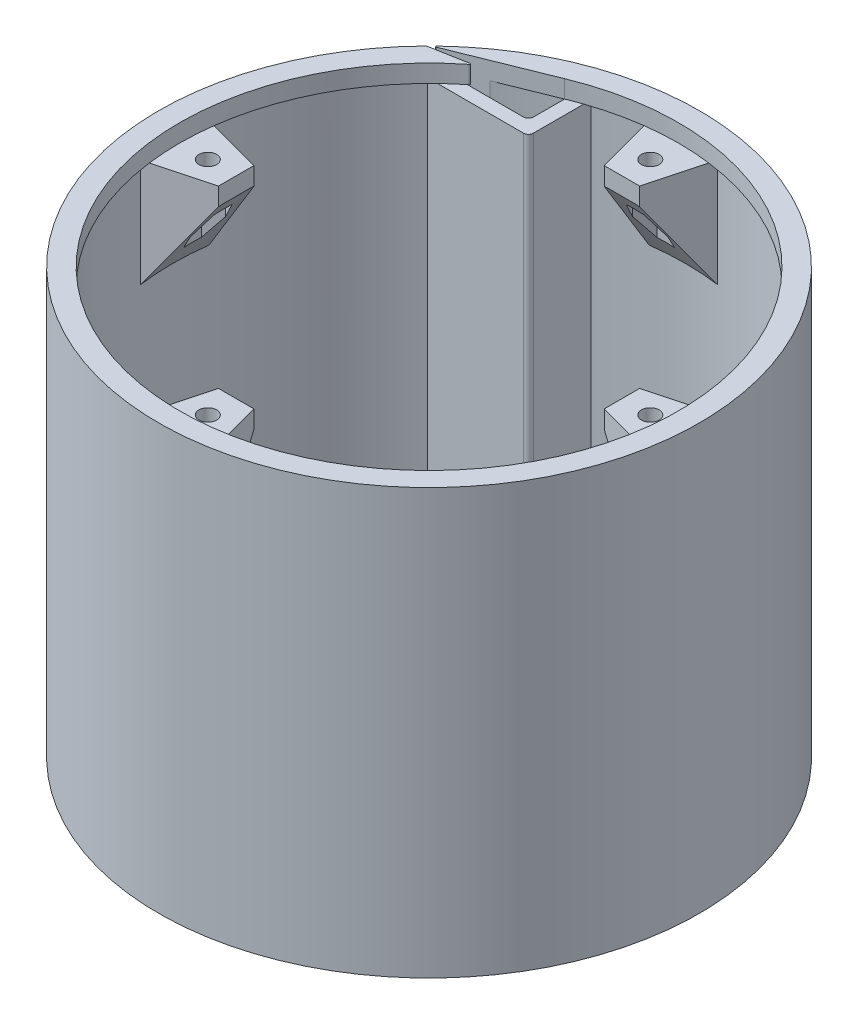
from build123d import *

# Parameters (mm, degrees)
SKETCH1_R           = 97.020853296
SKETCH1_R_2         = 92.020853296
BOSS_EXTRUDE1_DEPTH = 152.4
BOSS_EXTRUDE2_START = -6.35
SKETCH2_R           = 92.020853296
SKETCH2_R_2         = 89.535
BOSS_EXTRUDE2_DEPTH = 6.35
BOSS_EXTRUDE3_START = 6.35
SKETCH3_R           = 3.175
BOSS_EXTRUDE3_DEPTH = 6.35
CIRPATTERN1_COUNT   = 4
SKETCH4_R           = 3.175
BOSS_EXTRUDE4_DEPTH = 6.35
CHAMFER1_SIZE       = 32.28471384
CHAMFER1_SIZE_2     = 22.606
CUT_EXTRUDE1_DEPTH  = 25.4
CIRPATTERN2_COUNT   = 4
CUT_EXTRUDE6_START  = -152.4
CUT_EXTRUDE6_DEPTH  = 152.4
FILLET2_R           = 0.254
BOSS_EXTRUDE5_START = -152.4
BOSS_EXTRUDE5_DEPTH = 152.4
CUT_EXTRUDE8_START  = -6.35
CUT_EXTRUDE8_DEPTH  = 6.35
FILLET3_R           = 1.778


with BuildPart() as part:
    # Sketch1 → Boss-Extrude1 (new body)
    with BuildSketch(Plane(origin=(0, 0, 0), x_dir=(1, 0, 0), z_dir=(0, 1, 0))):
        with Locations(Location((0, 0, 0), (0, 0, 90))):
            Circle(SKETCH1_R)
        with Locations(Location((0, 0, 0), (0, 0, 90))):
            Circle(SKETCH1_R_2, mode=Mode.SUBTRACT)
    extrude(amount=BOSS_EXTRUDE1_DEPTH)

    # Sketch2 → Boss-Extrude2 (add)
    with BuildSketch(Plane(origin=(0, 152.4, 0), x_dir=(1, 0, 0), z_dir=(0, 1, 0)).offset(BOSS_EXTRUDE2_START)):
        with Locations(Location((0, 0, 0), (0, 0, 90))):
            Circle(SKETCH2_R)
        with Locations(Location((0, 0, 0), (0, 0, 270))):
            Circle(SKETCH2_R_2, mode=Mode.SUBTRACT)
    extrude(amount=BOSS_EXTRUDE2_DEPTH)

    # Sketch3 → Boss-Extrude3 (add)
    with BuildSketch(Plane.XZ.offset(-146.05).offset(BOSS_EXTRUDE3_START)):
        with BuildLine():
            Line((6.35, 69.215), (12.241655252, 91.20295674))
            ThreePointArc((12.241655252, 91.20295674), (0, 92.020853296), (-12.241655252, 91.20295674))
            Line((-12.241655252, 91.20295674), (-6.35, 69.215))
            Line((-6.35, 69.215), (6.35, 69.215))
        make_face()
        with Locations(Location((0, 79.375, 0), (0, 0, 270))):
            Circle(SKETCH3_R, mode=Mode.SUBTRACT)
    boss_extrude3 = extrude(amount=-BOSS_EXTRUDE3_DEPTH)

    # CirPattern1: Boss-Extrude3 ×4 about axis
    cirpattern1_axis = Axis((0, 0, 0), (0, 1, 0))
    for i in range(1, CIRPATTERN1_COUNT):
        add(boss_extrude3.rotate(cirpattern1_axis, i * 360 / CIRPATTERN1_COUNT))

    # Sketch4 → Boss-Extrude4 (add)
    # profile 1 of 9: a face of its own
    with BuildSketch(Plane.XZ):
        with BuildLine():
            Line((0, 34.925), (0, 7.62))
            Line((0, 7.62), (7.62, 7.62))
            Line((7.62, 7.62), (7.62, 91.704814712))
            ThreePointArc((7.62, 91.704814712), (3.813275508, 91.941809702), (0, 92.020853296))
            Line((0, 92.020853296), (0, 79.375))
            ThreePointArc((0, 79.375), (2.24506403, 78.44506403), (3.175, 76.2))
            ThreePointArc((3.175, 76.2), (2.24506403, 73.95493597), (0, 73.025))
            Line((0, 73.025), (0, 41.275))
            ThreePointArc((0, 41.275), (2.24506403, 40.34506403), (3.175, 38.1))
            ThreePointArc((3.175, 38.1), (2.24506403, 35.85493597), (0, 34.925))
        make_face()
    # profile 2 of 9: a face of its own
    with BuildSketch(Plane.XZ):
        with BuildLine():
            Line((-7.62, 7.62), (0, 7.62))
            Line((0, 7.62), (0, 34.925))
            ThreePointArc((0, 34.925), (-3.175, 38.1), (0, 41.275))
            Line((0, 41.275), (0, 73.025))
            ThreePointArc((0, 73.025), (-3.175, 76.2), (0, 79.375))
            Line((0, 79.375), (0, 92.020853296))
            ThreePointArc((0, 92.020853296), (-3.813275508, 91.941809702), (-7.62, 91.704814712))
            Line((-7.62, 91.704814712), (-7.62, 7.62))
        make_face()
    # profile 3 of 9: a face of its own
    with BuildSketch(Plane.XZ):
        with BuildLine():
            Line((7.62, 7.62), (7.62, 0))
            Line((7.62, 0), (7.62, -7.62))
            Line((7.62, -7.62), (91.704814712, -7.62))
            ThreePointArc((91.704814712, -7.62), (91.941809702, -3.813275508), (92.020853296, 0))
            ThreePointArc((92.020853296, 0), (91.941809702, 3.813275508), (91.704814712, 7.62))
            Line((91.704814712, 7.62), (7.62, 7.62))
        make_face()
        with Locations(Location((38.1, 0, 0), (0, 0, 270))):
            Circle(SKETCH4_R, mode=Mode.SUBTRACT)
        with Locations(Location((76.2, 0, 0), (0, 0, 270))):
            Circle(SKETCH4_R, mode=Mode.SUBTRACT)
    # profile 4 of 9: a face of its own
    with BuildSketch(Plane.XZ):
        with BuildLine():
            Line((7.62, -7.62), (0, -7.62))
            Line((0, -7.62), (-7.62, -7.62))
            Line((-7.62, -7.62), (-7.62, -91.704814712))
            ThreePointArc((-7.62, -91.704814712), (0, -92.020853296), (7.62, -91.704814712))
            Line((7.62, -91.704814712), (7.62, -7.62))
        make_face()
        with Locations(Location((0, -76.2, 0), (0, 0, 270))):
            Circle(SKETCH4_R, mode=Mode.SUBTRACT)
        with Locations(Location((0, -38.1, 0), (0, 0, 270))):
            Circle(SKETCH4_R, mode=Mode.SUBTRACT)
    # profile 5 of 9: a face of its own
    with BuildSketch(Plane.XZ):
        with BuildLine():
            Line((-7.62, -7.62), (-7.62, 0))
            Line((-7.62, 0), (-7.62, 7.62))
            Line((-7.62, 7.62), (-91.704814712, 7.62))
            ThreePointArc((-91.704814712, 7.62), (-92.020853296, 0), (-91.704814712, -7.62))
            Line((-91.704814712, -7.62), (-7.62, -7.62))
        make_face()
        with Locations(Location((-76.2, 0, 0), (0, 0, 270))):
            Circle(SKETCH4_R, mode=Mode.SUBTRACT)
        with Locations(Location((-38.1, 0, 0), (0, 0, 270))):
            Circle(SKETCH4_R, mode=Mode.SUBTRACT)
    # profile 6 of 9: a face of its own
    with BuildSketch(Plane.XZ):
        with BuildLine():
            ThreePointArc((-3.175, 0), (-2.24506403, 2.24506403), (0, 3.175))
            Line((0, 3.175), (0, 7.62))
            Line((0, 7.62), (-7.62, 7.62))
            Line((-7.62, 7.62), (-7.62, 0))
            Line((-7.62, 0), (-3.175, 0))
        make_face()
    # profile 7 of 9: a face of its own
    with BuildSketch(Plane.XZ):
        with BuildLine():
            Line((0, 7.62), (0, 3.175))
            ThreePointArc((0, 3.175), (2.24506403, 2.24506403), (3.175, 0))
            Line((3.175, 0), (7.62, 0))
            Line((7.62, 0), (7.62, 7.62))
            Line((7.62, 7.62), (0, 7.62))
        make_face()
    # profile 8 of 9: a face of its own
    with BuildSketch(Plane.XZ):
        with BuildLine():
            Line((7.62, 0), (3.175, 0))
            ThreePointArc((3.175, 0), (2.24506403, -2.24506403), (0, -3.175))
            Line((0, -3.175), (0, -7.62))
            Line((0, -7.62), (7.62, -7.62))
            Line((7.62, -7.62), (7.62, 0))
        make_face()
    # profile 9 of 9: a face of its own
    with BuildSketch(Plane.XZ):
        with BuildLine():
            ThreePointArc((0, -3.175), (-2.24506403, -2.24506403), (-3.175, 0))
            Line((-3.175, 0), (-7.62, 0))
            Line((-7.62, 0), (-7.62, -7.62))
            Line((-7.62, -7.62), (0, -7.62))
            Line((0, -7.62), (0, -3.175))
        make_face()
    extrude(amount=-BOSS_EXTRUDE4_DEPTH)

    # Chamfer1
    # the kernel refuses this chamfer: 32.28471384, 22.606 mm, written as the material it adds along each edge
    with BuildSketch(Plane(origin=(0, 139.7, 0), x_dir=(0.862152674351757, 0, 0.5066485627218467), z_dir=(0.5066485627218467, 0, -0.862152674351757))) as chamfer1_piece_1_section:
        Polygon((92.020853296, CHAMFER1_SIZE), (92.020853296 - CHAMFER1_SIZE_2, 0), (92.020853296, 0), align=None)
    chamfer1_piece_1 = revolve(axis=Axis((0, 139.7, 0), (0, -1, 0)), revolution_arc=119.118302195, mode=Mode.PRIVATE)
    chamfer1_piece_1 = split(chamfer1_piece_1, bisect_by=Plane(origin=(-11.379119343, 139.7, 3.049025839), z_dir=(-0.9659258262890701, 0, 0.2588190451025144)), keep=Keep.TOP, mode=Mode.PRIVATE)
    chamfer1_piece_1 = split(chamfer1_piece_1, bisect_by=Plane(origin=(11.379119343, 139.7, 3.049025839), z_dir=(0.965925826289068, 0, 0.25881904510252207)), keep=Keep.TOP, mode=Mode.PRIVATE)
    chamfer1_piece_1 = split(chamfer1_piece_1, bisect_by=Plane(origin=(0, 139.7, 69.215), z_dir=(0, 0, 1)), keep=Keep.TOP, mode=Mode.PRIVATE)
    chamfer1_piece_1 = chamfer1_piece_1 - Plane(origin=(0, 139.7, 79.375), x_dir=(0, 0, -1), z_dir=(0, -1, 0)) * Cylinder(3.175, 369, mode=Mode.PRIVATE)
    add(chamfer1_piece_1)
    with BuildSketch(Plane(origin=(0, 139.7, 0), x_dir=(0.506648562721847, 0, -0.862152674351757), z_dir=(-0.862152674351757, 0, -0.506648562721847))) as chamfer1_piece_2_section:
        Polygon((92.020853296, CHAMFER1_SIZE), (92.020853296 - CHAMFER1_SIZE_2, 0), (92.020853296, 0), align=None)
    chamfer1_piece_2 = revolve(axis=Axis((0, 139.7, 0), (0, -1, 0)), revolution_arc=119.118302195, mode=Mode.PRIVATE)
    chamfer1_piece_2 = split(chamfer1_piece_2, bisect_by=Plane(origin=(3.049025839, 139.7, 11.379119343), z_dir=(0.2588190451025143, 0, 0.9659258262890701)), keep=Keep.TOP, mode=Mode.PRIVATE)
    chamfer1_piece_2 = split(chamfer1_piece_2, bisect_by=Plane(origin=(3.049025839, 139.7, -11.379119343), z_dir=(0.2588190451025222, 0, -0.965925826289068)), keep=Keep.TOP, mode=Mode.PRIVATE)
    chamfer1_piece_2 = split(chamfer1_piece_2, bisect_by=Plane(origin=(69.215, 139.7, 0), z_dir=(1, 0, 0)), keep=Keep.TOP, mode=Mode.PRIVATE)
    chamfer1_piece_2 = chamfer1_piece_2 - Plane(origin=(79.375, 139.7, 0), x_dir=(-1, 0, 0), z_dir=(0, -1, 0)) * Cylinder(3.175, 369, mode=Mode.PRIVATE)
    add(chamfer1_piece_2)
    with BuildSketch(Plane(origin=(0, 139.7, 0), x_dir=(-0.862148683822554, 0, -0.5066553532560746), z_dir=(-0.5066553532560746, 0, 0.862148683822554))) as chamfer1_piece_3_section:
        Polygon((92.020853296, CHAMFER1_SIZE), (92.020853296 - CHAMFER1_SIZE_2, 0), (92.020853296, 0), align=None)
    chamfer1_piece_3 = revolve(axis=Axis((0, 139.7, 0), (0, -1, 0)), revolution_arc=59.55869982, mode=Mode.PRIVATE)
    chamfer1_piece_3 = split(chamfer1_piece_3, bisect_by=Plane(origin=(11.379119343, 139.7, -3.049025839), z_dir=(0.9659258262890701, 0, -0.2588190451025143)), keep=Keep.TOP, mode=Mode.PRIVATE)
    chamfer1_piece_3 = split(chamfer1_piece_3, bisect_by=Plane(origin=(0, 139.7, -69.215), z_dir=(0, 0, -1)), keep=Keep.TOP, mode=Mode.PRIVATE)
    chamfer1_piece_3 = chamfer1_piece_3 - Plane(origin=(0, 139.7, -79.375), x_dir=(0, 0, 1), z_dir=(0, -1, 0)) * Cylinder(3.175, 369, mode=Mode.PRIVATE)
    add(chamfer1_piece_3)
    with BuildSketch(Plane(origin=(0, 139.7, 0), x_dir=(-0.506648562721847, 0, 0.862152674351757), z_dir=(0.862152674351757, 0, 0.506648562721847))) as chamfer1_piece_4_section:
        Polygon((92.020853296, CHAMFER1_SIZE), (92.020853296 - CHAMFER1_SIZE_2, 0), (92.020853296, 0), align=None)
    chamfer1_piece_4 = revolve(axis=Axis((0, 139.7, 0), (0, -1, 0)), revolution_arc=119.118302195, mode=Mode.PRIVATE)
    chamfer1_piece_4 = split(chamfer1_piece_4, bisect_by=Plane(origin=(-3.049025839, 139.7, -11.379119343), z_dir=(-0.25881904510251413, 0, -0.96592582628907)), keep=Keep.TOP, mode=Mode.PRIVATE)
    chamfer1_piece_4 = split(chamfer1_piece_4, bisect_by=Plane(origin=(-3.049025839, 139.7, 11.379119343), z_dir=(-0.2588190451025223, 0, 0.9659258262890679)), keep=Keep.TOP, mode=Mode.PRIVATE)
    chamfer1_piece_4 = split(chamfer1_piece_4, bisect_by=Plane(origin=(-69.215, 139.7, 0), z_dir=(-1, 0, 0)), keep=Keep.TOP, mode=Mode.PRIVATE)
    chamfer1_piece_4 = chamfer1_piece_4 - Plane(origin=(-79.375, 139.7, 0), x_dir=(1, 0, 0), z_dir=(0, -1, 0)) * Cylinder(3.175, 369, mode=Mode.PRIVATE)
    add(chamfer1_piece_4)
    with BuildSketch(Plane(origin=(0, 139.7, 0), x_dir=(0, 0, -1), z_dir=(-1, 0, 0))) as chamfer1_piece_5_section:
        Polygon((92.020853296, CHAMFER1_SIZE), (92.020853296 - CHAMFER1_SIZE_2, 0), (92.020853296, 0), align=None)
    chamfer1_piece_5 = revolve(axis=Axis((0, 139.7, 0), (0, -1, 0)), revolution_arc=59.55869982, mode=Mode.PRIVATE)
    chamfer1_piece_5 = split(chamfer1_piece_5, bisect_by=Plane(origin=(-11.379119343, 139.7, -3.049025839), z_dir=(-0.965925826289068, 0, -0.2588190451025222)), keep=Keep.TOP, mode=Mode.PRIVATE)
    chamfer1_piece_5 = split(chamfer1_piece_5, bisect_by=Plane(origin=(0, 139.7, -69.215), z_dir=(0, 0, -1)), keep=Keep.TOP, mode=Mode.PRIVATE)
    chamfer1_piece_5 = chamfer1_piece_5 - Plane(origin=(0, 139.7, -79.375), x_dir=(0, 0, 1), z_dir=(0, -1, 0)) * Cylinder(3.175, 369, mode=Mode.PRIVATE)
    add(chamfer1_piece_5)

    # Sketch5 → Cut-Extrude1 (cut)
    with BuildSketch(Plane(origin=(0, 139.7, 0), x_dir=(1, 0, 0), z_dir=(0, 1, 0))):
        Polygon((-73.875, 3.175426481), (-79.375, 6.350852961), (-84.875, 3.175426481), (-84.875, -3.175426481), (-79.375, -6.350852961), (-73.875, -3.175426481), align=None)
    cut_extrude1 = extrude(amount=-CUT_EXTRUDE1_DEPTH, mode=Mode.SUBTRACT)

    # CirPattern2: Cut-Extrude1 ×4 about axis
    cirpattern2_axis = Axis((0, 0, 0), (0, 1, 0))
    for i in range(1, CIRPATTERN2_COUNT):
        add(cut_extrude1.rotate(cirpattern2_axis, i * 360 / CIRPATTERN2_COUNT), mode=Mode.SUBTRACT)

    # Sketch12 → Cut-Extrude6 (cut)
    with BuildSketch(Plane(origin=(0, 152.4, 0), x_dir=(1, 0, 0), z_dir=(0, 1, 0)).offset(CUT_EXTRUDE6_START)):
        with BuildLine():
            Line((-34.16013974, 82.762316775), (-68.153623489, 69.051644293))
            ThreePointArc((-68.153623489, 69.051644293), (-68.604103282, 68.604103282), (-69.051644293, 68.153623489))
            Line((-69.051644293, 68.153623489), (-54.89191059, 70.734675915))
            ThreePointArc((-54.89191059, 70.734675915), (-44.930312186, 77.445356684), (-34.16013974, 82.762316775))
        make_face()
    extrude(amount=CUT_EXTRUDE6_DEPTH, mode=Mode.SUBTRACT)

    # Fillet2
    fillet2_edges = [part.edges().sort_by_distance(p)[0] for p in [
        (-54.89191059, 149.225, -70.734675915),
        (-69.051644293, 76.2, -68.153623489),
        (-53.203312881, 73.025, -75.081588554),
        (-68.153623489, 76.2, -69.051644293),
    ]]
    fillet(fillet2_edges, radius=FILLET2_R)

    # Sketch13 → Boss-Extrude5 (add)
    with BuildSketch(Plane(origin=(0, 152.4, 0), x_dir=(1, 0, 0), z_dir=(0, 1, 0)).offset(BOSS_EXTRUDE5_START)):
        with BuildLine():
            ThreePointArc((-29.16013974, 84.653425656), (-31.674256448, 83.745195107), (-34.16013974, 82.762316775))
            Line((-34.16013974, 82.762316775), (-34.16013974, 69.812634456))
            Line((-34.16013974, 69.812634456), (-56.059899173, 69.812634456))
            ThreePointArc((-56.059899173, 69.812634456), (-58.96920457, 67.373207861), (-61.772474775, 64.812634456))
            Line((-61.772474775, 64.812634456), (-29.16013974, 64.812634456))
            Line((-29.16013974, 64.812634456), (-29.16013974, 84.653425656))
        make_face()
        with BuildLine():
            Line((-34.16013974, 85.445434602), (-34.16013974, 82.762316775))
            ThreePointArc((-34.16013974, 82.762316775), (-31.674256448, 83.745195107), (-29.16013974, 84.653425656))
            Line((-29.16013974, 84.653425656), (-29.16013974, 87.278426267))
            ThreePointArc((-29.16013974, 87.278426267), (-31.673402295, 86.398107783), (-34.16013974, 85.445434602))
        make_face()
        with BuildLine():
            ThreePointArc((-61.772474775, 64.812634456), (-58.96920457, 67.373207861), (-56.059899173, 69.812634456))
            Line((-56.059899173, 69.812634456), (-59.950258645, 69.812634456))
            ThreePointArc((-59.950258645, 69.812634456), (-62.686750985, 67.366228129), (-65.323501561, 64.812634456))
            Line((-65.323501561, 64.812634456), (-61.772474775, 64.812634456))
        make_face()
    extrude(amount=BOSS_EXTRUDE5_DEPTH)

    # Sketch14 → Cut-Extrude8 (cut)
    with BuildSketch(Plane(origin=(0, 152.4, 0), x_dir=(1, 0, 0), z_dir=(0, 1, 0)).offset(CUT_EXTRUDE8_START)):
        with BuildLine():
            ThreePointArc((-29.16013974, 84.653425656), (-31.674256448, 83.745195107), (-34.16013974, 82.762316775))
            Line((-34.16013974, 82.762316775), (-34.16013974, 69.812634456))
            Line((-34.16013974, 69.812634456), (-56.059899173, 69.812634456))
            ThreePointArc((-56.059899173, 69.812634456), (-58.96920457, 67.373207861), (-61.772474775, 64.812634456))
            Line((-61.772474775, 64.812634456), (-29.16013974, 64.812634456))
            Line((-29.16013974, 64.812634456), (-29.16013974, 84.653425656))
        make_face()
    extrude(amount=CUT_EXTRUDE8_DEPTH, mode=Mode.SUBTRACT)

    # Fillet3
    fillet3_edges = [part.edges().sort_by_distance(p)[0] for p in [
        (-34.16013974, 73.025, -85.445434602),
        (-29.16013974, 73.025, -64.812634456),
        (-34.16013974, 73.025, -69.812634456),
    ]]
    fillet(fillet3_edges, radius=FILLET3_R)


solid = part.part
